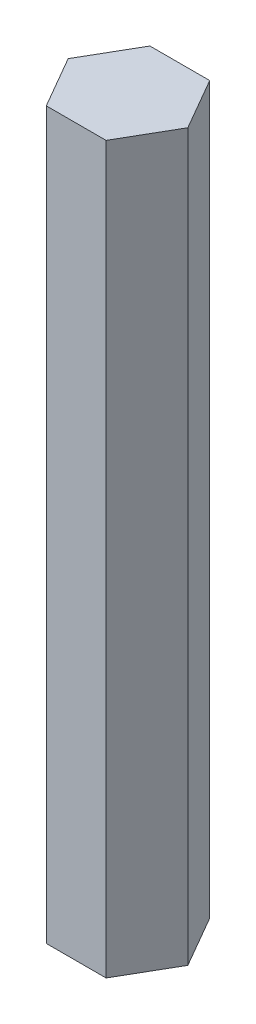
from build123d import *

# Parameters (mm, degrees)
BOSS_EXTRUDE1_DEPTH = 88.9


with BuildPart() as part:
    # Sketch1 → Boss-Extrude1 (new body)
    with BuildSketch(Plane(origin=(0, 0, 0), x_dir=(1, 0, 0), z_dir=(0, 1, 0))):
        Polygon((7.332348419, 0), (3.666174209, 6.35), (-3.666174209, 6.35), (-7.332348419, 0), (-3.666174209, -6.35), (3.666174209, -6.35), align=None)
    extrude(amount=BOSS_EXTRUDE1_DEPTH)


solid = part.part
